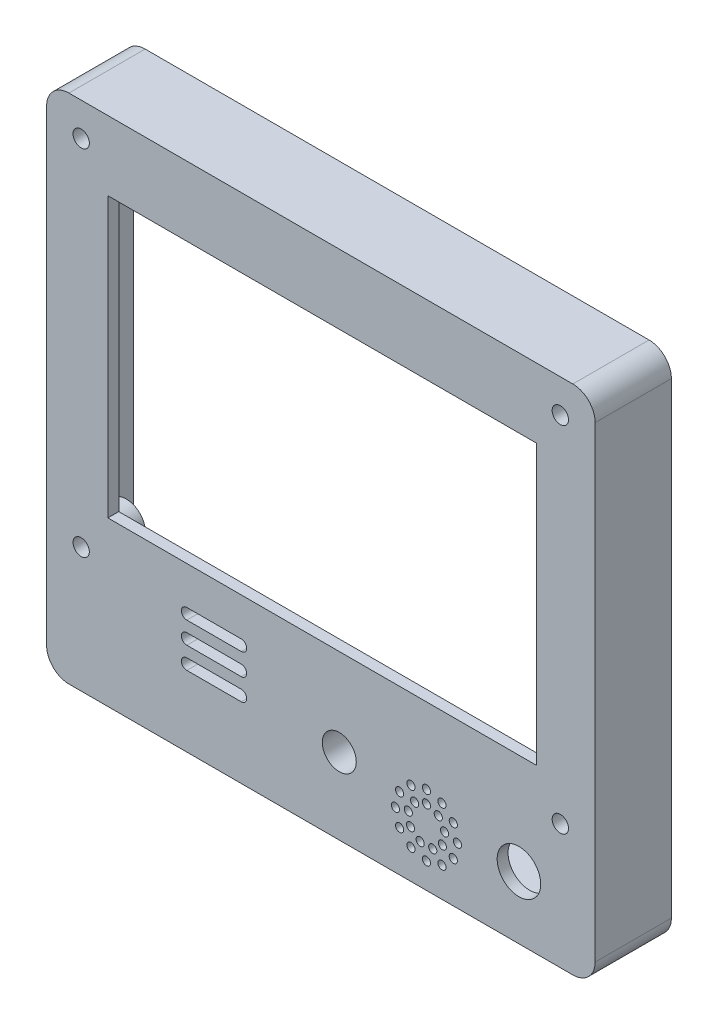
from build123d import *

# Parameters (mm, degrees)
SKETCH1_W           = 100.75
SKETCH1_H           = 94
BOSS_EXTRUDE1_DEPTH = 14
SHELL1_T            = -2
SKETCH2_R           = 3.5
SKETCH2_R_2         = 4
BOSS_EXTRUDE2_DEPTH = 6.3
SKETCH3_R           = 1.5
SKETCH3_R_2         = 4
SKETCH3_R_3         = 3.125
SKETCH3_R_4         = 0.75
SKETCH3_W           = 78.75
SKETCH3_H           = 51.25
CUT_EXTRUDE1_DEPTH  = 71.303916143
FILLET1_R           = 4.1


with BuildPart() as part:
    # Sketch1 → Boss-Extrude1 (new body)
    with BuildSketch(Plane.XY):
        Rectangle(SKETCH1_W, SKETCH1_H)
    extrude(amount=BOSS_EXTRUDE1_DEPTH)

    # Shell1
    shell1_openings = [part.faces().sort_by_distance(p)[0] for p in [
        (0, 0, 0),
    ]]
    offset(amount=SHELL1_T, openings=shell1_openings, kind=Kind.INTERSECTION)

    # Sketch2 → Boss-Extrude2 (add)
    with BuildSketch(Plane(origin=(0, 0, 12), x_dir=(-1, 0, 0), z_dir=(0, 0, -1))):
        with Locations((-43.975, 40.9)):
            Circle(SKETCH2_R)
        with Locations((-43.975, -24.1)):
            Circle(SKETCH2_R)
        with Locations((44.025, 40.9)):
            Circle(SKETCH2_R)
        with Locations((44.025, -24.1)):
            Circle(SKETCH2_R)
        with Locations((-3.375, -33)):
            Circle(SKETCH2_R_2)
    extrude(amount=BOSS_EXTRUDE2_DEPTH)

    # Sketch3 → Cut-Extrude1 (cut, through all)
    with BuildSketch(Plane.XY.offset(14)):
        with Locations((-44.025, 40.9)):
            Circle(SKETCH3_R)
        with Locations((43.975, 40.9)):
            Circle(SKETCH3_R)
        with Locations((43.975, -24.1)):
            Circle(SKETCH3_R)
        with Locations((-44.025, -24.1)):
            Circle(SKETCH3_R)
        with Locations((36.375, -35.5)):
            Circle(SKETCH3_R_2)
        with Locations((3.375, -33)):
            Circle(SKETCH3_R_3)
        with Locations((19.388263363, -33.242972513)):
            Circle(SKETCH3_R_4)
        with Locations((21.559750082, -34.033329043)):
            Circle(SKETCH3_R_4)
        with Locations((22.715174032, -36.034582029)):
            Circle(SKETCH3_R_4)
        with Locations((22.313899506, -38.310322957)):
            Circle(SKETCH3_R_4)
        with Locations((20.543687313, -39.795707355)):
            Circle(SKETCH3_R_4)
        with Locations((18.232839412, -39.795707355)):
            Circle(SKETCH3_R_4)
        with Locations((16.46262722, -38.310322957)):
            Circle(SKETCH3_R_4)
        with Locations((16.061352693, -36.034582029)):
            Circle(SKETCH3_R_4)
        with Locations((17.216776643, -34.033329043)):
            Circle(SKETCH3_R_4)
        with Locations((19.388263363, -30.927009025)):
            Circle(SKETCH3_R_4)
        with Locations((22.235361921, -31.689886784)):
            Circle(SKETCH3_R_4)
        with Locations((24.319582721, -33.774107583)):
            Circle(SKETCH3_R_4)
        with Locations((25.08246048, -36.621206142)):
            Circle(SKETCH3_R_4)
        with Locations((24.319582721, -39.468304701)):
            Circle(SKETCH3_R_4)
        with Locations((22.235361921, -41.5525255)):
            Circle(SKETCH3_R_4)
        with Locations((19.388263363, -42.31540326)):
            Circle(SKETCH3_R_4)
        with Locations((16.541164804, -41.5525255)):
            Circle(SKETCH3_R_4)
        with Locations((14.456944005, -39.468304701)):
            Circle(SKETCH3_R_4)
        with Locations((13.694066245, -36.621206142)):
            Circle(SKETCH3_R_4)
        with Locations((14.456944005, -33.774107583)):
            Circle(SKETCH3_R_4)
        with Locations((16.541164804, -31.689886784)):
            Circle(SKETCH3_R_4)
        with Locations((0.25, 8.625)):
            Rectangle(SKETCH3_W, SKETCH3_H)
        with BuildLine():
            Line((-24.625, -24), (-14.625, -24))
            ThreePointArc((-14.625, -24), (-13.625, -25), (-14.625, -26))
            Line((-14.625, -26), (-24.625, -26))
            ThreePointArc((-24.625, -26), (-25.625, -25), (-24.625, -24))
        make_face()
        with BuildLine():
            Line((-24.625, -28), (-14.625, -28))
            ThreePointArc((-14.625, -28), (-13.625, -29), (-14.625, -30))
            Line((-14.625, -30), (-24.625, -30))
            ThreePointArc((-24.625, -30), (-25.625, -29), (-24.625, -28))
        make_face()
        with BuildLine():
            Line((-24.625, -32), (-14.625, -32))
            ThreePointArc((-14.625, -32), (-13.625, -33), (-14.625, -34))
            Line((-14.625, -34), (-24.625, -34))
            ThreePointArc((-24.625, -34), (-25.625, -33), (-24.625, -32))
        make_face()
    extrude(amount=-CUT_EXTRUDE1_DEPTH, mode=Mode.SUBTRACT)

    # Fillet1
    fillet1_edges = [part.edges().sort_by_distance(p)[0] for p in [
        (-50.375, -47, 7),
        (-50.375, 47, 7),
        (50.375, 47, 7),
        (50.375, -47, 7),
    ]]
    fillet(fillet1_edges, radius=FILLET1_R)


solid = part.part
